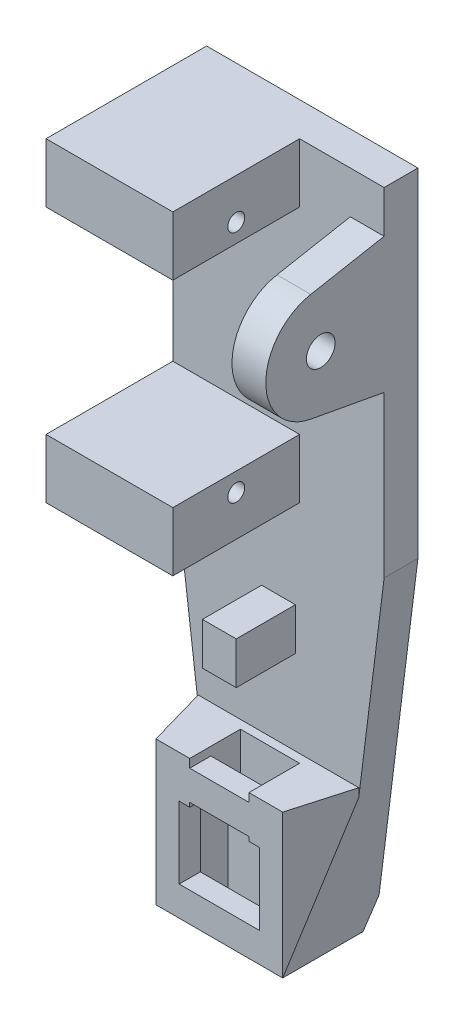
from build123d import *
from OCP.BRepFilletAPI import BRepFilletAPI_MakeChamfer

# Parameters (mm, degrees)
RESSALTO_EXTRUS_O1_DEPTH = 4
ESBO_O2_W                = 15
ESBO_O2_H                = 7
ESBO_O2_W_2              = 4
ESBO_O2_H_2              = 16
RESSALTO_EXTRUS_O2_DEPTH = 15
ESBO_O3_R                = 1
CORTE_EXTRUS_O1_DEPTH    = 84.582294776
ESBO_O10_R               = 1.7
CORTE_EXTRUS_O4_DEPTH    = 10
RESSALTO_EXTRUS_O3_DEPTH = 17
RESSALTO_EXTRUS_O4_REACH = 84.348
ESBO_O7_W                = 4
ESBO_O7_H                = 5
ESBO_O8_W                = 15
ESBO_O8_H                = 3.5
RESSALTO_EXTRUS_O5_DEPTH = 2.5
CHANFRO2_SIZE            = 7
CHANFRO2_SIZE_2          = 2
CHANFRO3_SIZE            = 1.5
CHANFRO3_SIZE2           = 3.216760381


with BuildPart() as part:
    # Esboço1 → Ressalto-extrusão1 (new body)
    with BuildSketch(Plane.XY):
        Polygon((-12.5, 0), (12.5, 0), (12.5, -40), (7.5, -80), (-7.5, -80), (-12.5, -40), align=None)
    extrude(amount=RESSALTO_EXTRUS_O1_DEPTH)

    # Esboço2 → Ressalto-extrusão2 (add)
    with BuildSketch(Plane.XY.offset(4)):
        with Locations((-5, -33.8)):
            Rectangle(ESBO_O2_W, ESBO_O2_H)
        with Locations((-5, -3.5)):
            Rectangle(ESBO_O2_W, ESBO_O2_H)
        with Locations((10.5, -13)):
            Rectangle(ESBO_O2_W_2, ESBO_O2_H_2)
    extrude(amount=RESSALTO_EXTRUS_O2_DEPTH)

    # Esboço3 → Corte-extrusão1 (cut, through all)
    with BuildSketch(Plane(origin=(2.5, 0, 0), x_dir=(0, 0, -1), z_dir=(1, 0, 0))):
        with Locations(Location((-11.5, -4.8, 0), (0, 0, 90))):
            Circle(ESBO_O3_R)
        with Locations(Location((-11.5, -32.5, 0), (0, 0, 90))):
            Circle(ESBO_O3_R)
    extrude(amount=-CORTE_EXTRUS_O1_DEPTH, mode=Mode.SUBTRACT)

    # Esboço10 → Corte-extrusão4 (cut)
    with BuildSketch(Plane(origin=(12.5, 0, 0), x_dir=(0, 0, -1), z_dir=(1, 0, 0))):
        with Locations((-11.5, -13)):
            Circle(ESBO_O10_R)
        with BuildLine():
            Line((-4, -5), (-19, -5))
            Line((-19, -5), (-19, -21))
            Line((-19, -21), (-4, -21))
            Line((-4, -21), (-12.684004699, -19.391254405))
            ThreePointArc((-12.684004699, -19.391254405), (-18, -13), (-12.684004699, -6.608745595))
            Line((-12.684004699, -6.608745595), (-4, -5))
        make_face()
    extrude(amount=-CORTE_EXTRUS_O4_DEPTH, mode=Mode.SUBTRACT)

    # Esboço6 → Ressalto-extrusão3 (add)
    with BuildSketch(Plane.XZ.offset(80)):
        Polygon((-5, 5), (-5, 8.5), (-4.75, 8.5), (-4.75, 11), (-7.5, 11), (-7.5, 4), (7.5, 4), (7.5, 11), (4.75, 11), (4.75, 8.5), (5, 8.5), (5, 5), align=None)
    extrude(amount=-RESSALTO_EXTRUS_O3_DEPTH)

    # Ressalto-extrusão4: up to this face of the body (flat: up to its plane)
    ressalto_extrus_o4_end = Plane(part.part.faces().sort_by_distance((-6.125, -71.5, 11))[0])
    # Esboço7 → Ressalto-extrusão4 (add, up to the picked face)
    with BuildSketch(Plane.XY.offset(4), mode=Mode.PRIVATE) as ressalto_extrus_o4_sk1:
        with Locations((0, -50.5)):
            Rectangle(ESBO_O7_W, ESBO_O7_H)
    ressalto_extrus_o4_tool1 = split(extrude(ressalto_extrus_o4_sk1.sketch, amount=RESSALTO_EXTRUS_O4_REACH, mode=Mode.PRIVATE), bisect_by=ressalto_extrus_o4_end, keep=Keep.BOTH, mode=Mode.PRIVATE)
    # Esboço7 → Ressalto-extrusão4 (add, up to the picked face)
    with BuildSketch(Plane.XY.offset(4), mode=Mode.PRIVATE) as ressalto_extrus_o4_sk2:
        with Locations((5.5, -65.5)):
            Rectangle(ESBO_O7_W, ESBO_O7_H)
    ressalto_extrus_o4_tool2 = split(extrude(ressalto_extrus_o4_sk2.sketch, amount=RESSALTO_EXTRUS_O4_REACH, mode=Mode.PRIVATE), bisect_by=ressalto_extrus_o4_end, keep=Keep.BOTH, mode=Mode.PRIVATE)
    # Esboço7 → Ressalto-extrusão4 (add, up to the picked face)
    with BuildSketch(Plane.XY.offset(4), mode=Mode.PRIVATE) as ressalto_extrus_o4_sk3:
        with Locations((-5.5, -65.5)):
            Rectangle(ESBO_O7_W, ESBO_O7_H)
    ressalto_extrus_o4_tool3 = split(extrude(ressalto_extrus_o4_sk3.sketch, amount=RESSALTO_EXTRUS_O4_REACH, mode=Mode.PRIVATE), bisect_by=ressalto_extrus_o4_end, keep=Keep.BOTH, mode=Mode.PRIVATE)
    add(ressalto_extrus_o4_tool1.solids().sort_by(Axis((0, -50.5, 4), (0, 0, 1)))[0])
    add(ressalto_extrus_o4_tool2.solids().sort_by(Axis((5.5, -65.5, 4), (0, 0, 1)))[0])
    add(ressalto_extrus_o4_tool3.solids().sort_by(Axis((-5.5, -65.5, 4), (0, 0, 1)))[0])

    # Esboço8 → Ressalto-extrusão5 (add)
    with BuildSketch(Plane.XY.offset(11)):
        with Locations((0, -78.25)):
            Rectangle(ESBO_O8_W, ESBO_O8_H)
        with Locations((0, -65.75)):
            Rectangle(ESBO_O8_W, ESBO_O8_H)
    extrude(amount=-RESSALTO_EXTRUS_O5_DEPTH)

    # Chanfro2
    chanfro2_edges_1 = [part.edges().sort_by_distance(p)[0] for p in [
        (7.5, -71.5, 4),
    ]]
    chanfro2_side_1 = [part.faces().sort_by_distance(p)[0] for p in [
        (7.5, -71.5, 4.04),
    ]]
    chanfro2_edges_2 = [part.edges().sort_by_distance(p)[0] for p in [
        (-7.5, -71.5, 4),
    ]]
    chanfro2_side_2 = [part.faces().sort_by_distance(p)[0] for p in [
        (-7.5, -71.5, 4.04),
    ]]
    chanfro2 = BRepFilletAPI_MakeChamfer(part.part.solid().wrapped)
    for e in chanfro2_edges_1:
        chanfro2.Add(CHANFRO2_SIZE - 0.0001, CHANFRO2_SIZE_2 - 0.0001, e.wrapped, chanfro2_side_1[0].wrapped)
    for e in chanfro2_edges_2:
        chanfro2.Add(CHANFRO2_SIZE - 0.0001, CHANFRO2_SIZE_2 - 0.0001, e.wrapped, chanfro2_side_2[0].wrapped)
    add(Compound.cast(chanfro2.Shape()), mode=Mode.REPLACE)  # a hair under: the kernel refuses the full size

    # Chanfro3
    chanfro3_edges = [part.edges().sort_by_distance(p)[0] for p in [
        (0, -80, 0),
    ]]
    chanfro3_side = [part.faces().sort_by_distance(p)[0] for p in [
        (7.313989248, -80, 10.99995),
    ]]
    chamfer(chanfro3_edges, length=CHANFRO3_SIZE, length2=CHANFRO3_SIZE2, reference=chanfro3_side[0])


solid = part.part
